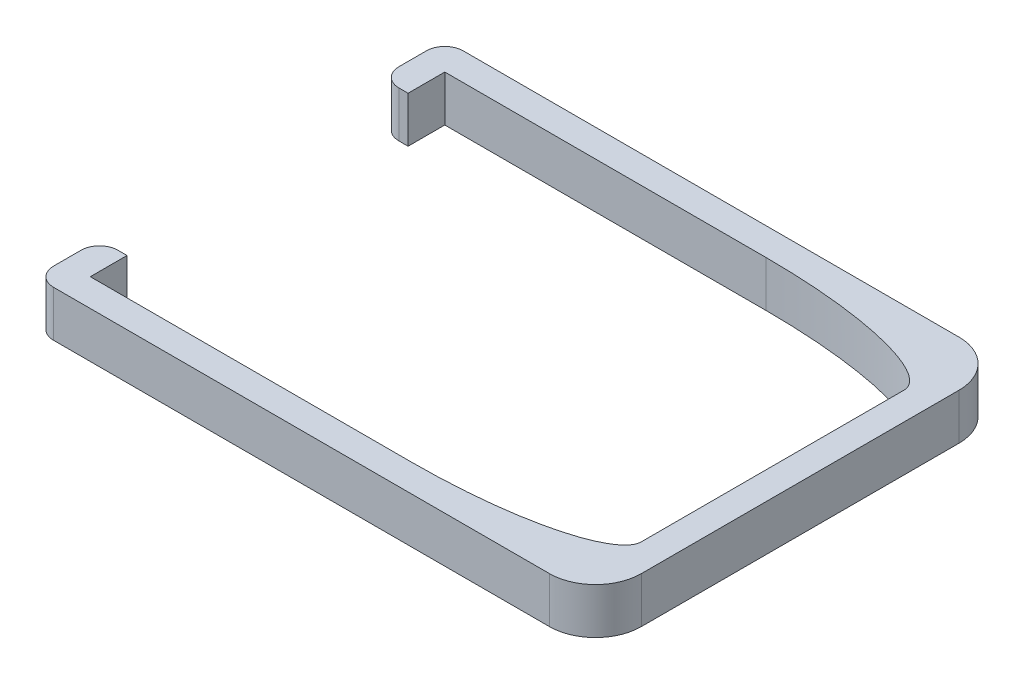
from build123d import *

# Parameters (mm, degrees)
BOSS_EXTRUDE1_DEPTH = 5
FILLET1_SIZE        = 20
FILLET1_SIZE_2      = 5
FILLET2_R           = 2
FILLET3_R           = 5


with BuildPart() as part:
    # Sketch1 → Boss-Extrude1 (new body)
    with BuildSketch(Plane(origin=(0, 0, 0), x_dir=(1, 0, 0), z_dir=(0, 1, 0))):
        Polygon((0, 0), (55, 0), (55, -38.6), (0, -38.6), (0, -34.6), (-3, -34.6), (-3, -41.6), (1.5, -41.6), (58, -41.6), (58, 3), (0, 3), (-3, 3), (-3, -4), (0, -4), align=None)
    extrude(amount=BOSS_EXTRUDE1_DEPTH)

    # Fillet1
    # an asymmetric fillet: 20, 5 mm, written as the material it adds along each edge
    with BuildSketch(Plane(origin=(55, 0, 0), x_dir=(-1, 0, 0), z_dir=(0, 1, 0))) as fillet1_piece_1:
        with BuildLine():
            Bezier((FILLET1_SIZE, 0), (0, 0), (0, FILLET1_SIZE_2), weights=[1, 0.707106781, 1])
            Line((0, FILLET1_SIZE_2), (0, 0))
            Line((0, 0), (FILLET1_SIZE, 0))
        make_face()
    extrude(amount=5)
    with BuildSketch(Plane(origin=(55, 0, 38.6), x_dir=(-1, 0, 0), z_dir=(0, 1, 0))) as fillet1_piece_2:
        with BuildLine():
            Bezier((FILLET1_SIZE, 0), (0, 0), (0, -FILLET1_SIZE_2), weights=[1, 0.707106781, 1])
            Line((0, -FILLET1_SIZE_2), (0, 0))
            Line((0, 0), (FILLET1_SIZE, 0))
        make_face()
    extrude(amount=5)

    # Fillet2
    fillet2_edges = [part.edges().sort_by_distance(p)[0] for p in [
        (-3, 2.5, 4),
        (-3, 2.5, -3),
        (-3, 2.5, 41.6),
        (-3, 2.5, 34.6),
    ]]
    fillet(fillet2_edges, radius=FILLET2_R)

    # Fillet3
    fillet3_edges = [part.edges().sort_by_distance(p)[0] for p in [
        (58, 2.5, -3),
        (58, 2.5, 41.6),
    ]]
    fillet(fillet3_edges, radius=FILLET3_R)


solid = part.part
